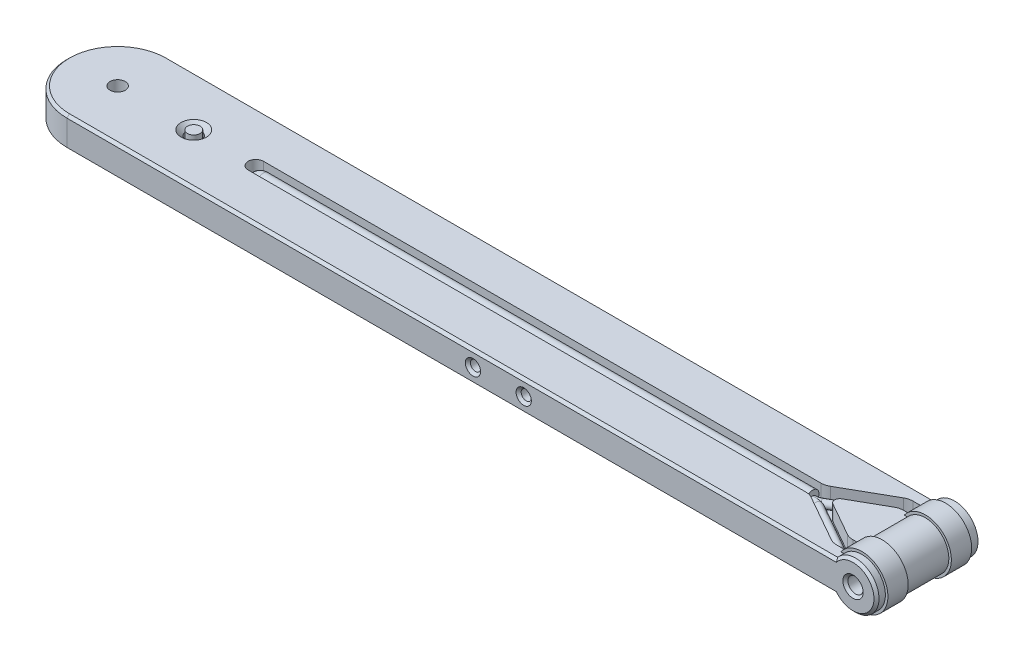
from build123d import *
from build123d.topology import SkipClean

# Parameters (mm, degrees)
SALIENTE_EXTRUIR1_DEPTH                = 10
REVOLUCI_N1_START                      = -8.25
REVOLUCI_N1_DEPTH                      = 4
REVOLUCI_N1_START_2                    = 4.25
REVOLUCI_N1_2_DEPTH                    = 4
CORTAR_EXTRUIR1_DEPTH                  = 3
CORTAR_EXTRUIR2_DEPTH                  = 176.734618815
CORTAR_EXTRUIR2_DEPTH_BACK             = 176.734618815
CROQUIS5_R                             = 1.5
CROQUIS7_W                             = 1.5
CROQUIS7_H                             = 20
CHAFL_N1_SIZE                          = 1
CROQUIS8_R                             = 3
CORTAR_EXTRUIR3_DEPTH                  = 1
CHAFL_N2_SIZE                          = 2
CROQUIS9_R                             = 0.75
CROQUIS14_R                            = 1.25
DI_METRO_DE_TALADRO_2_0_2_1_AT_2_COUNT = 2
DI_METRO_DE_TALADRO_2_0_2_1_AT_2_PITCH = 10
CROQUIS18_R                            = 1.25
CHAFL_N3_SIZE                          = 0.5


# Read off the part's stored shape, not the designer's step: Revolución1
with BuildPart() as part:
    # Croquis1 → Saliente-Extruir1 (new, symmetric)
    with BuildSketch(Plane.XY):
        with BuildLine():
            Line((-175.375, 3), (-175.375, -3))
            Line((-175.375, -3), (-3.52003196, -3))
            ThreePointArc((-3.52003196, -3), (4.625, 0), (-3.52003196, 3))
            Line((-3.52003196, 3), (-175.375, 3))
        make_face()
    extrude(amount=SALIENTE_EXTRUIR1_DEPTH, both=True)

    # Croquis4 → Cortar-Extruir1 (cut)
    with BuildSketch(Plane(origin=(0, 3, 0), x_dir=(1, 0, 0), z_dir=(0, 1, 0))):
        with BuildLine():
            Line((-4.155192535, 7.5), (-5.692749875, 7.5))
            ThreePointArc((-5.692749875, 7.5), (-6.459199802, 7.400440399), (-7.174778097, 7.108369672))
            Line((-7.174778097, 7.108369672), (-16.356239343, 1.891630328))
            ThreePointArc((-16.356239343, 1.891630328), (-17.071817639, 1.599559601), (-17.838267566, 1.5))
            Line((-17.838267566, 1.5), (-127.655192535, 1.5))
            ThreePointArc((-127.655192535, 1.5), (-129.155192535, 0), (-127.655192535, -1.5))
            Line((-127.655192535, -1.5), (-17.838267566, -1.5))
            ThreePointArc((-17.838267566, -1.5), (-17.071817639, -1.599559601), (-16.356239343, -1.891630328))
            Line((-16.356239343, -1.891630328), (-7.174778097, -7.108369672))
            ThreePointArc((-7.174778097, -7.108369672), (-6.459199802, -7.400440399), (-5.692749875, -7.5))
            Line((-5.692749875, -7.5), (-4.155192535, -7.5))
            Line((-4.155192535, -7.5), (-4.155192535, -5))
            Line((-4.155192535, -5), (-5.032117503, -5))
            ThreePointArc((-5.032117503, -5), (-5.798567431, -4.900440399), (-6.514145726, -4.608369672))
            Line((-6.514145726, -4.608369672), (-13.094632808, -0.869456557))
            ThreePointArc((-13.094632808, -0.869456557), (-13.6006234, 0), (-13.094632808, 0.869456557))
            Line((-13.094632808, 0.869456557), (-6.514145726, 4.608369672))
            ThreePointArc((-6.514145726, 4.608369672), (-5.798567431, 4.900440399), (-5.032117503, 5))
            Line((-5.032117503, 5), (-4.155192535, 5))
            Line((-4.155192535, 5), (-4.155192535, 7.5))
        make_face()
    extrude(amount=-CORTAR_EXTRUIR1_DEPTH, mode=Mode.SUBTRACT)

    # Croquis5 → Cortar-Extruir2 (cut, two sides: drawn at the far end of the back side and taken through both)
    with SkipClean():  # the faces are left unmerged after this step: merging them gives an invalid solid
        with BuildSketch(Plane(origin=(0, 0, 0), x_dir=(1, 0, 0), z_dir=(0, 1, 0)).offset(-CORTAR_EXTRUIR2_DEPTH_BACK)):
            with Locations(Location((-127.655192535, 0, 0), (0, 0, 270))):
                Circle(CROQUIS5_R)
            with Locations(Location((-154.875, 0, 0), (0, 0, 270))):
                Circle(CROQUIS5_R)
            with Locations(Location((-139.875, 0, 0), (0, 0, 270))):
                Circle(CROQUIS5_R)
            with BuildLine():
                Line((-154.875, -10), (-175.375, -10))
                Line((-175.375, -10), (-175.375, 10))
                Line((-175.375, 10), (-154.875, 10))
                ThreePointArc((-154.875, 10), (-164.875, 0), (-154.875, -10))
            make_face()
        extrude(amount=CORTAR_EXTRUIR2_DEPTH + CORTAR_EXTRUIR2_DEPTH_BACK, mode=Mode.SUBTRACT)
    add(part.part.scale(1), mode=Mode.REPLACE)  # the faces are merged on a copy

    # Croquis7 → Taladros de espiga de Ø3.0mm2 (revolve, cut)
    with BuildSketch(Plane(origin=(0, 0, 10), x_dir=(0, -1, 0), z_dir=(1, 0, 0))):
        with Locations((0.75, 10)):
            Rectangle(CROQUIS7_W, CROQUIS7_H)
    revolve(axis=Axis((0, 0, 16.35), (0, 0, -1)), mode=Mode.SUBTRACT)

    # Chaflán1
    chafl_n1_edges = [part.edges().sort_by_distance(p)[0] for p in [
        (-139.875, -3, -1.5),
        (-139.875, 3, -1.5),
        (-127.655192535, -3, -1.5),
    ]]
    chamfer(chafl_n1_edges, length=CHAFL_N1_SIZE)

    # Croquis8 → Cortar-Extruir3 (cut)
    with BuildSketch(Plane.XZ.offset(3)):
        with Locations(Location((-154.875, 0, 0), (0, 0, 270))):
            Circle(CROQUIS8_R)
    extrude(amount=-CORTAR_EXTRUIR3_DEPTH, mode=Mode.SUBTRACT)

    # Chaflán2
    # the kernel refuses this chamfer: 2 mm, written as the material it takes off along each edge
    with BuildSketch(Plane(origin=(-154.875, -2, 0), x_dir=(0, 0, 1), z_dir=(-1, 0, 0))) as chafl_n2_piece_1_section:
        Polygon((1.5, CHAFL_N2_SIZE), (1.5 + CHAFL_N2_SIZE, 0), (1.5, 0), align=None)
    chafl_n2_piece_1 = revolve(axis=Axis((-154.875, -2, 0), (0, 1, 0)), mode=Mode.PRIVATE)
    chafl_n2_piece_1 = chafl_n2_piece_1 & Plane(origin=(-154.875, -0.742805432, 0), x_dir=(0, 0, -1), z_dir=(0, -1, 0)) * Cylinder(3, 14, mode=Mode.PRIVATE)
    add(chafl_n2_piece_1, mode=Mode.SUBTRACT)

    # Croquis15 → Diámetro de taladro Ø2.0 (2)1 (revolve, cut)
    with BuildSketch(Plane(origin=(-74.875, 0, 10), x_dir=(0, -1, 0), z_dir=(1, 0, 0))):
        Polygon((0, 0), (0, 4.600860619), (1, 4), (1, 0), align=None)
    di_metro_de_taladro_2_0_2_1 = revolve(axis=Axis((-74.875, 0, 16.35), (0, 0, -1)), mode=Mode.SUBTRACT)

    # Diámetro de taladro Ø2.0 (2)1 at 2: Diámetro de taladro Ø2.0 (2)1 ×2
    with Locations(*[(i * DI_METRO_DE_TALADRO_2_0_2_1_AT_2_PITCH, 0, 0) for i in range(1, DI_METRO_DE_TALADRO_2_0_2_1_AT_2_COUNT)]):
        add(di_metro_de_taladro_2_0_2_1, mode=Mode.SUBTRACT)

    # Simetría2: Diámetro de taladro Ø2.0 (2)1 across plane
    add(di_metro_de_taladro_2_0_2_1.mirror(Plane.XY), mode=Mode.SUBTRACT)

    # Simetría2 copy 1 sketch → Simetría2 copy 1 (revolve, cut)
    with BuildSketch(Plane(origin=(-64.875, 0, -10), x_dir=(0, -1, 0), z_dir=(1, 0, 0))):
        Polygon((0, 0), (0, -4.600860619), (1, -4), (1, 0), align=None)
    revolve(axis=Axis((-64.875, 0, -16.35), (0, 0, -1)), mode=Mode.SUBTRACT)

    # Chaflán3
    chafl_n3_edges = [part.edges().sort_by_distance(p)[0] for p in [
        (0, 1.5, 10),
        (4.625, 0, 10),
        (-64.875, 1, 10),
        (-74.875, 1, 10),
        (-79.19751598, 3, 10),
        (-79.19751598, 3, -10),
        (-79.19751598, -3, -10),
        (-79.19751598, -3, 10),
        (-164.875, 3, 0),
        (-164.875, -3, 0),
    ]]
    chamfer(chafl_n3_edges, length=CHAFL_N3_SIZE)


with BuildPart() as body_2:
    # Revolución1 outline → Revolución1 (new body)
    with BuildSketch(Plane.XY.offset(REVOLUCI_N1_START)):
        with BuildLine():
            ThreePointArc((-3.52003196, 3), (4.625, 0), (-3.52003196, -3))
            Line((-3.52003196, -3), (-4.155192535, -3))
            ThreePointArc((-4.155192535, -3), (5.125, 0), (-4.155192535, 3))
            Line((-4.155192535, 3), (-3.52003196, 3))
        make_face()
    extrude(amount=REVOLUCI_N1_DEPTH)


with BuildPart() as body_3:
    # Revoluci_n1 2 outline → Revoluci_n1 2 (new body)
    with BuildSketch(Plane.XY.offset(REVOLUCI_N1_START_2)):
        with BuildLine():
            ThreePointArc((-3.52003196, 3), (4.625, 0), (-3.52003196, -3))
            Line((-3.52003196, -3), (-4.155192535, -3))
            ThreePointArc((-4.155192535, -3), (5.125, 0), (-4.155192535, 3))
            Line((-4.155192535, 3), (-3.52003196, 3))
        make_face()
    extrude(amount=REVOLUCI_N1_2_DEPTH)


with BuildPart() as body_4:
    # Barrer4: sweep along a path in Croquis10
    with BuildLine(Plane(origin=(0, 0, 0), x_dir=(1, 0, 0), z_dir=(0, 1, 0))) as barrer4_path:
        Line((-4.155192535, -6.25), (-5.692749875, -6.25))
        ThreePointArc((-5.692749875, -6.25), (-6.139845666, -6.191923566), (-6.557266338, -6.021548975))
        Line((-6.557266338, -6.021548975), (-15.738727584, -0.804809631))
        Line((-15.738727584, -0.804809631), (-16.465923158, -0.391630328))
        ThreePointArc((-16.465923158, -0.391630328), (-17.181501453, -0.099559601), (-17.947951381, 0))
        Line((-17.947951381, 0), (-126.155192535, 0))
    # Croquis9 → Barrer4 (sweep)
    with BuildSketch(Plane.ZY.offset(4.155192535)):
        with Locations((6.25, 0.75)):
            Circle(CROQUIS9_R)
    sweep(path=barrer4_path.line)

    # Simetría1: body 4 across plane


with BuildPart() as body_4_1:
    add(body_4.part)
    add(body_4.part.mirror(Plane.XY))

    # Barrer6: sweep along a curve in space
    with BuildLine() as barrer6_path:
        Line((-126.405192535, -0.25, 0), (-126.405192535, -2, 0))
        ThreePointArc((-126.155192535, 0, 0), (-126.33196923, -0.073223305, 0), (-126.405192535, -0.25, 0))
        Line((-126.155192535, 0, 0), (-17.947951381, 0, 0))
    # Croquis14 → Barrer6 (sweep)
    with BuildSketch(Plane(origin=(0, -2, 0), x_dir=(1, 0, 0), z_dir=(0, 1, 0))):
        with Locations((-127.655192535, 0)):
            Circle(CROQUIS14_R)
    sweep(path=barrer6_path.line)

    # Barrer8: sweep along a path in Croquis19
    with BuildLine(Plane.XY) as barrer8_path:
        Line((-128.905192535, -2), (-128.905192535, -2.1))
        ThreePointArc((-128.905192535, -2.1), (-129.344532363, -3.160660172), (-130.405192535, -3.6))
        Line((-130.405192535, -3.6), (-137.125, -3.6))
        ThreePointArc((-137.125, -3.6), (-138.185660172, -3.160660172), (-138.625, -2.1))
        Line((-138.625, -2.1), (-138.625, -2))
        Line((-138.625, -2), (-138.625, 3))
    # Croquis18 → Barrer8 (sweep)
    with BuildSketch(Plane.XZ.offset(2)):
        with Locations((-127.655192535, 0)):
            Circle(CROQUIS18_R)
    sweep(path=barrer8_path.line)


solid = Compound([part.part, body_2.part, body_3.part, body_4_1.part])
